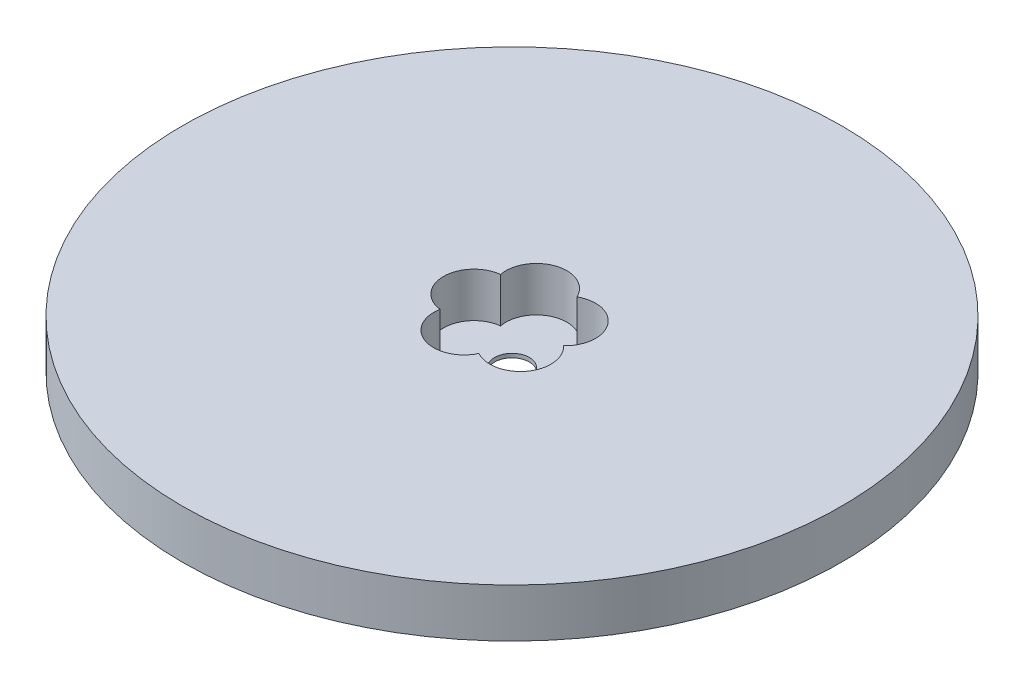
from build123d import *

# Parameters (mm, degrees)
SKETCH1_R           = 95
BOSS_EXTRUDE1_DEPTH = 14
SKETCH2_R           = 5
CUT_EXTRUDE1_DEPTH  = 136.077755386
SKETCH3_R           = 8.797146217
CUT_EXTRUDE2_DEPTH  = 12.856004293
CIRPATTERN1_COUNT   = 5


with BuildPart() as part:
    # Sketch1 → Boss-Extrude1 (new body)
    with BuildSketch(Plane(origin=(0, 0, 0), x_dir=(1, 0, 0), z_dir=(0, 1, 0))):
        Circle(SKETCH1_R)
    extrude(amount=BOSS_EXTRUDE1_DEPTH)

    # Sketch2 → Cut-Extrude1 (cut, through all)
    with BuildSketch(Plane(origin=(0, 0, 0), x_dir=(1, 0, 0), z_dir=(0, 1, 0))):
        Circle(SKETCH2_R)
    extrude(amount=CUT_EXTRUDE1_DEPTH, mode=Mode.SUBTRACT)

    # Sketch3 → Cut-Extrude2 (cut)
    with BuildSketch(Plane(origin=(0, 14, 0), x_dir=(1, 0, 0), z_dir=(0, 1, 0))):
        with Locations((-10.953492751, 0)):
            Circle(SKETCH3_R)
    cut_extrude2 = extrude(amount=-CUT_EXTRUDE2_DEPTH, mode=Mode.SUBTRACT)

    # CirPattern1: Cut-Extrude2 ×5 about axis
    cirpattern1_axis = Axis((0, 0, 0), (0, 1, 0))
    for i in range(1, CIRPATTERN1_COUNT):
        add(cut_extrude2.rotate(cirpattern1_axis, i * 360 / CIRPATTERN1_COUNT), mode=Mode.SUBTRACT)


solid = part.part
